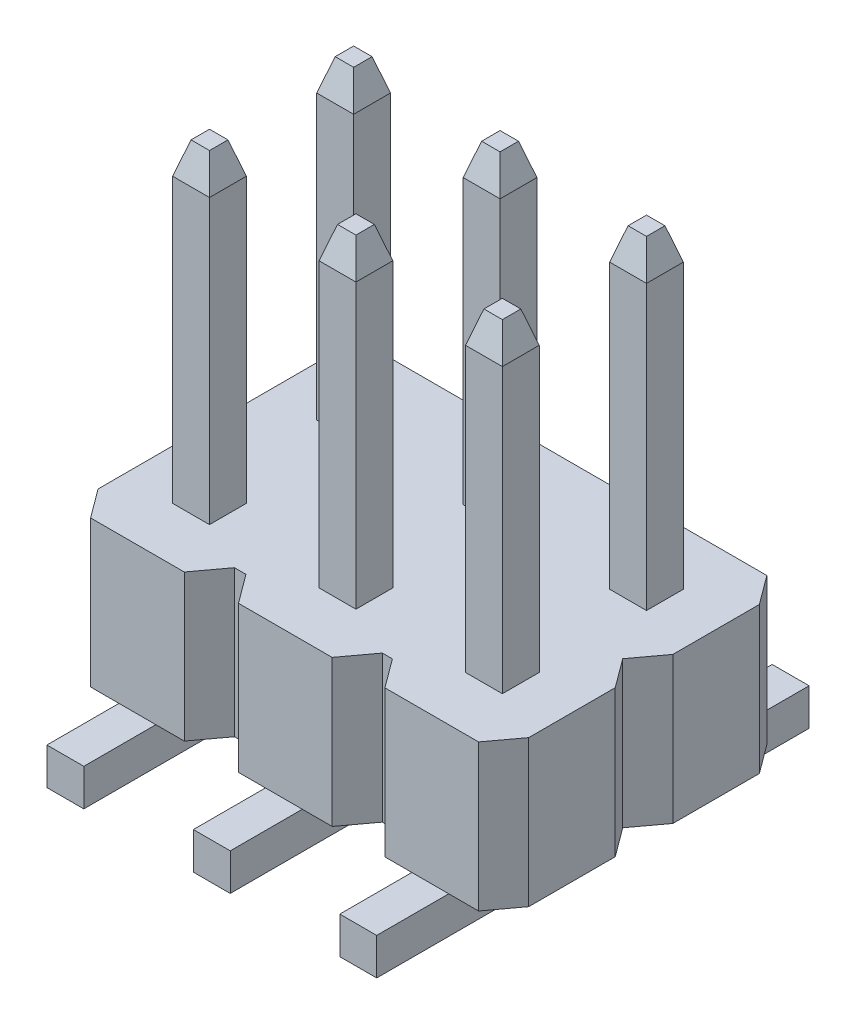
from build123d import *

# Parameters (mm, degrees)
BOSS_EXTRUDE3_DEPTH = 2.54
BOSS_EXTRUDE4_DEPTH = 2.54
LPATTERN1_COUNT     = 2
LPATTERN1_PITCH     = 2.54
BOSS_EXTRUDE5_DEPTH = 0.32
CHAMFER1_SIZE       = 0.16
CHAMFER1_SIZE2      = 0.5458
LPATTERN2_START     = 2.38
LPATTERN2_DEPTH     = 0.32
LPATTERN2_START_2   = 4.92
LPATTERN2_2_DEPTH   = 0.32
LPATTERN2_START_3   = 2.22
LPATTERN2_3_DEPTH   = 0.64
LPATTERN2_START_4   = 4.76
LPATTERN2_4_DEPTH   = 0.64
LPATTERN2_START_5   = -0.32
LPATTERN2_5_DEPTH   = 0.64
LPATTERN2_START_6   = 1
LPATTERN2_6_DEPTH   = 5
SKETCH9_W           = 6.730038924
SKETCH9_H           = 1
BOSS_EXTRUDE6_DEPTH = 2.54


with BuildPart() as part:
    # Sketch6 → Boss-Extrude3 (new body)
    with BuildSketch(Plane(origin=(0, 0, 0), x_dir=(1, 0, 0), z_dir=(0, 1, 0))):
        Polygon((-1.1825, 0.75), (-1.1825, -0.75), (-0.812519462, -1.25), (0.812519462, -1.25), (1.1825, -0.75), (1.1825, 0.75), (0.812519462, 1.25), (-0.812519462, 1.25), align=None)
    extrude(amount=BOSS_EXTRUDE3_DEPTH)

    # Sketch7 → Boss-Extrude4 (add)
    with BuildSketch(Plane(origin=(0, 0, 0), x_dir=(1, 0, 0), z_dir=(0, 1, 0))):
        Polygon((1.1825, 0.75), (1.1825, -0.75), (1.3825, -0.75), (1.752480538, -1.25), (3.377519462, -1.25), (3.7475, -0.75), (3.7475, 0.75), (3.377519462, 1.25), (1.752480538, 1.25), (1.3825, 0.75), align=None)
    boss_extrude4 = extrude(amount=BOSS_EXTRUDE4_DEPTH)

    # LPattern1: Boss-Extrude4 ×2
    with Locations(*[(i * LPATTERN1_PITCH, 0, 0) for i in range(1, LPATTERN1_COUNT)]):
        add(boss_extrude4)

    # Sketch8 → Boss-Extrude5 (add, symmetric)
    with BuildSketch(Plane(origin=(0, 0, 0), x_dir=(0, 0, -1), z_dir=(1, 0, 0))):
        with BuildLine():
            Line((0.32, 0), (0.32, 8))
            Line((0.32, 8), (-0.32, 8))
            Line((-0.32, 8), (-0.32, 0))
            ThreePointArc((-0.32, 0), (-0.13254834, -0.45254834), (0.32, -0.64))
            Line((0.32, -0.64), (2.5, -0.64))
            Line((2.5, -0.64), (2.5, 0))
            Line((2.5, 0), (0.32, 0))
        make_face()
    extrude(amount=BOSS_EXTRUDE5_DEPTH, both=True)

    # Chamfer1
    chamfer1_edges = [part.edges().sort_by_distance(p)[0] for p in [
        (-0.32, 8, 0),
        (0, 8, -0.32),
        (0, 8, 0.32),
        (0.32, 8, 0),
    ]]
    chamfer1_side = [part.faces().sort_by_distance(p)[0] for p in [
        (0, 8, 0),
    ]]
    chamfer(chamfer1_edges, length=CHAMFER1_SIZE, length2=CHAMFER1_SIZE2, reference=chamfer1_side[0])

    # LPattern2: read off the stored shape, not the designer's step
    # LPattern2 outline → LPattern2 (add)
    with BuildSketch(Plane.YZ.offset(LPATTERN2_START)):
        with BuildLine():
            Line((-0.64, -0.32), (-0.64, -2.5))
            Line((-0.64, -2.5), (0, -2.5))
            Line((0, -2.5), (0, 0.32))
            ThreePointArc((0, 0.32), (-0.45254834, 0.13254834), (-0.64, -0.32))
        make_face()
        Polygon((2.54, -0.32), (7.4542, -0.32), (8, -0.16), (8, 0.16), (7.4542, 0.32), (2.54, 0.32), align=None)
    extrude(amount=LPATTERN2_DEPTH)

    # LPattern2 2 outline → LPattern2 2 (add)
    with BuildSketch(Plane.YZ.offset(LPATTERN2_START_2)):
        with BuildLine():
            Line((-0.64, -0.32), (-0.64, -2.5))
            Line((-0.64, -2.5), (0, -2.5))
            Line((0, -2.5), (0, 0.32))
            ThreePointArc((0, 0.32), (-0.45254834, 0.13254834), (-0.64, -0.32))
        make_face()
        Polygon((2.54, -0.32), (7.4542, -0.32), (8, -0.16), (8, 0.16), (7.4542, 0.32), (2.54, 0.32), align=None)
    extrude(amount=LPATTERN2_2_DEPTH)

    # LPattern2 3 outline → LPattern2 3 (add)
    with BuildSketch(Plane.YZ.offset(LPATTERN2_START_3)):
        with BuildLine():
            Line((-0.64, -0.32), (-0.64, -2.5))
            Line((-0.64, -2.5), (0, -2.5))
            Line((0, -2.5), (0, 0.32))
            ThreePointArc((0, 0.32), (-0.45254834, 0.13254834), (-0.64, -0.32))
        make_face()
    extrude(amount=LPATTERN2_3_DEPTH)

    # LPattern2 4 outline → LPattern2 4 (add)
    with BuildSketch(Plane.YZ.offset(LPATTERN2_START_4)):
        with BuildLine():
            Line((-0.64, -0.32), (-0.64, -2.5))
            Line((-0.64, -2.5), (0, -2.5))
            Line((0, -2.5), (0, 0.32))
            ThreePointArc((0, 0.32), (-0.45254834, 0.13254834), (-0.64, -0.32))
        make_face()
    extrude(amount=LPATTERN2_4_DEPTH)

    # LPattern2 5 outline → LPattern2 5 (add)
    with BuildSketch(Plane.XY.offset(LPATTERN2_START_5)):
        Polygon((5.24, 8), (5.24, 2.54), (5.4, 2.54), (5.4, 7.4542), align=None)
        Polygon((4.76, 7.4542), (4.76, 2.54), (4.92, 2.54), (4.92, 8), align=None)
        Polygon((2.7, 8), (2.7, 2.54), (2.86, 2.54), (2.86, 7.4542), align=None)
        Polygon((2.22, 7.4542), (2.22, 2.54), (2.38, 2.54), (2.38, 8), align=None)
    extrude(amount=LPATTERN2_5_DEPTH)

    # LPattern2 6 outline → LPattern2 6 (cut)
    with BuildSketch(Plane.YZ.offset(LPATTERN2_START_6)):
        Polygon((7.4542, 0.32), (8, 0.16), (8, 0.32), align=None)
        Polygon((7.4542, -0.32), (8, -0.32), (8, -0.16), align=None)
    extrude(amount=LPATTERN2_6_DEPTH, mode=Mode.SUBTRACT)

    # Mirror1: part across plane


with BuildPart() as part_1:
    add(part.part)
    add(part.part.mirror(Plane(origin=(-0.812519462, 2.54, 1.25), x_dir=(1, 0, 0), z_dir=(0, 0, -1))))

    # Sketch9 → Boss-Extrude6 (add)
    with BuildSketch(Plane.XZ):
        with Locations((2.5525, 1.25)):
            Rectangle(SKETCH9_W, SKETCH9_H)
    extrude(amount=-BOSS_EXTRUDE6_DEPTH)


solid = part_1.part
